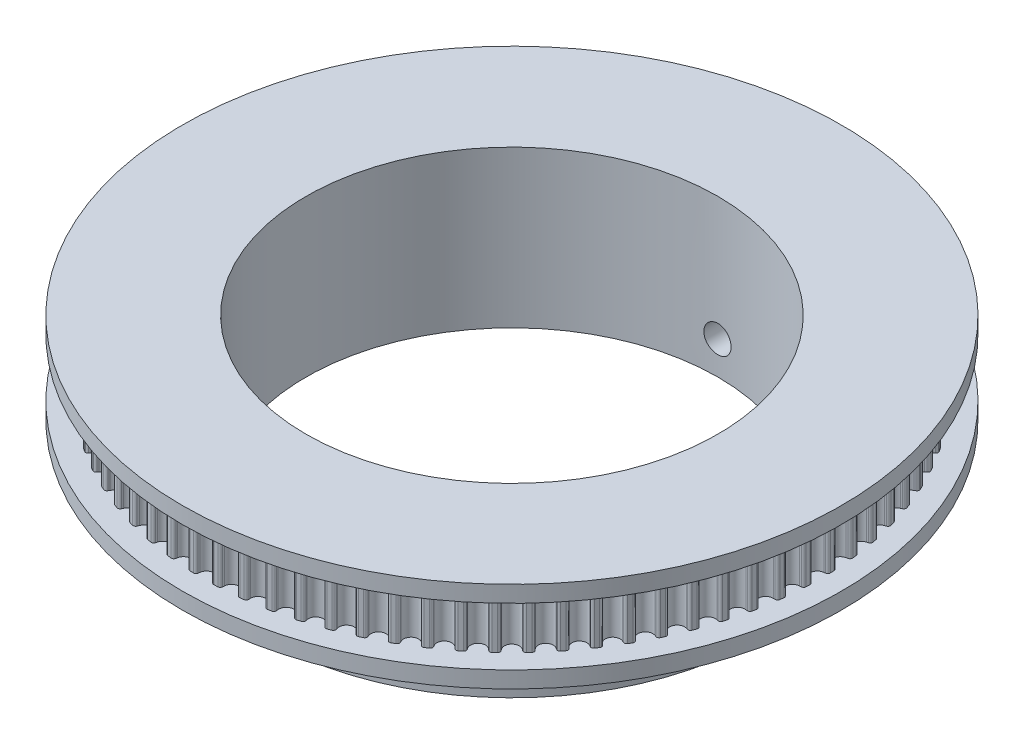
from build123d import *

# Parameters (mm, degrees)
SKETCH_1_R               = 40
EXTRUDE_1_DEPTH          = 5.5
SKETCH_2_OUTSIDE_W       = 104.734
SKETCH_2_OUTSIDE_H       = 104.734
CUT_EXTRUDE_1_DEPTH      = 3.5
SKETCH_3_R               = 25
CUT_EXTRUDE_2_DEPTH      = 58.628118137
SKETCH_4_R               = 30
SKETCH_4_R_2             = 25
EXTRUDE_2_DEPTH          = 8
SKETCH_7_W               = 1.65
SKETCH_7_H               = 40
PATTERN_CIRCULAR_1_COUNT = 3
PATTERN_CIRCULAR_1_ANGLE = 180


with BuildPart() as part:
    # 草图1 → 凸台-拉伸1 (new, symmetric)
    with BuildSketch(Plane(origin=(0, 0, 0), x_dir=(1, 0, 0), z_dir=(0, 1, 0))):
        Circle(SKETCH_1_R)
    extrude(amount=EXTRUDE_1_DEPTH, both=True)

    # 草图2 outside → 切除-拉伸1 (cut, symmetric)
    with BuildSketch(Plane(origin=(0, 0, 0), x_dir=(1, 0, 0), z_dir=(0, 1, 0))):
        Rectangle(SKETCH_2_OUTSIDE_W, SKETCH_2_OUTSIDE_H)
        with BuildLine():
            Line((-0.927435551, 37.150343182), (-0.903216998, 36.953098898))
            ThreePointArc((-0.903216998, 36.953098898), (0, 36.154), (0.903216998, 36.953098898))
            Line((0.903216998, 36.953098898), (0.927435551, 37.150343182))
            ThreePointArc((0.927435551, 37.150343182), (1.030147603, 37.34171833), (1.235097598, 37.413619043))
            ThreePointArc((1.235097598, 37.413619043), (1.469651943, 37.405139743), (1.704148514, 37.395189983))
            ThreePointArc((1.704148514, 37.395189983), (1.902825451, 37.307430724), (1.990205755, 37.108586826))
            Line((1.990205755, 37.108586826), (1.998874042, 36.910050415))
            ThreePointArc((1.998874042, 36.910050415), (2.836610147, 36.042549284), (3.799739405, 36.768319237))
            Line((3.799739405, 36.768319237), (3.839358909, 36.963055317))
            ThreePointArc((3.839358909, 36.963055317), (3.956769455, 37.145781825), (4.166728922, 37.201380701))
            ThreePointArc((4.166728922, 37.201380701), (4.399894936, 37.174524618), (4.632887983, 37.146207141))
            ThreePointArc((4.632887983, 37.146207141), (4.824066954, 37.043130401), (4.895576781, 36.838043694))
            Line((4.895576781, 36.838043694), (4.88864136, 36.639439198))
            ThreePointArc((4.88864136, 36.639439198), (5.655731649, 35.708884266), (6.672835156, 36.356850662))
            Line((6.672835156, 36.356850662), (6.727611342, 36.547877925))
            ThreePointArc((6.727611342, 36.547877925), (6.858996507, 36.720829223), (7.072670977, 36.759783477))
            ThreePointArc((7.072670977, 36.759783477), (7.303011114, 36.714716187), (7.533064158, 36.668205579))
            ThreePointArc((7.533064158, 36.668205579), (7.71556648, 36.550446862), (7.770764949, 36.340381772))
            Line((7.770764949, 36.340381772), (7.748268577, 36.142933654))
            ThreePointArc((7.748268577, 36.142933654), (8.439983685, 35.155062102), (9.504790658, 35.721230013))
            Line((9.504790658, 35.721230013), (9.574385814, 35.907370713))
            ThreePointArc((9.574385814, 35.907370713), (9.718935565, 36.069480498), (9.935007664, 36.091549963))
            ThreePointArc((9.935007664, 36.091549963), (10.1611018, 36.028549321), (10.386796487, 35.964132337))
            ThreePointArc((10.386796487, 35.964132337), (10.559496973, 35.832417663), (10.598043766, 35.618669312))
            Line((10.598043766, 35.618669312), (10.560125143, 35.423594906))
            ThreePointArc((10.560125143, 35.423594906), (11.172200415, 34.38449729), (12.278145966, 34.865376102))
            Line((12.278145966, 34.865376102), (12.362131014, 35.045482619))
            ThreePointArc((12.362131014, 35.045482619), (12.518954154, 35.195751431), (12.736091724, 35.200800042))
            ThreePointArc((12.736091724, 35.200800042), (12.956545915, 35.120254469), (13.176490761, 35.038328259))
            ThreePointArc((13.176490761, 35.038328259), (13.338324655, 34.893469694), (13.359982119, 34.677355911))
            Line((13.359982119, 34.677355911), (13.306875025, 34.485857915))
            ThreePointArc((13.306875025, 34.485857915), (13.835536814, 33.401940618), (14.97580242, 33.794565553))
            Line((14.97580242, 33.794565553), (15.073659565, 33.967527471))
            ThreePointArc((15.073659565, 33.967527471), (15.241789227, 34.105028853), (15.458653544, 34.093025483))
            ThreePointArc((15.458653544, 34.093025483), (15.672108615, 33.995431569), (15.884947589, 33.896501237))
            ThreePointArc((15.884947589, 33.896501237), (16.034917131, 33.739391881), (16.03955174, 33.52224508))
            Line((16.03955174, 33.52224508), (15.971583597, 33.335504143))
            ThreePointArc((15.971583597, 33.335504143), (16.413572528, 32.213449876), (17.581128073, 32.51540027))
            Line((17.581128073, 32.51540027), (17.692253993, 32.680151221))
            ThreePointArc((17.692253993, 32.680151221), (17.870653601, 32.804037431), (18.085907624, 32.775056085))
            ThreePointArc((18.085907624, 32.775056085), (18.291047554, 32.661015529), (18.495468432, 32.545691012))
            ThreePointArc((18.495468432, 32.545691012), (18.63264901, 32.377299498), (18.620232191, 32.16045846))
            Line((18.620232191, 32.16045846), (18.537822046, 31.979625902))
            ThreePointArc((18.537822046, 31.979625902), (18.890413109, 30.826352502), (20.078060225, 31.035766732))
            Line((20.078060225, 31.035766732), (20.201769792, 31.191290972))
            ThreePointArc((20.201769792, 31.191290972), (20.389339453, 31.30079821), (20.60165607, 31.255017568))
            ThreePointArc((20.60165607, 31.255017568), (20.797216103, 31.125233467), (20.991958562, 30.99422578))
            ThreePointArc((20.991958562, 30.99422578), (21.115504412, 30.815590297), (21.086112718, 30.60039192))
            Line((21.086112718, 30.60039192), (20.989768657, 30.426582634))
            ThreePointArc((20.989768657, 30.426582634), (21.250788011, 29.249200415), (22.451204459, 29.364787372))
            Line((22.451204459, 29.364787372), (22.586734961, 29.510126042))
            ThreePointArc((22.586734961, 29.510126042), (22.782318247, 29.604579159), (22.990388455, 29.542281474))
            ThreePointArc((22.990388455, 29.542281474), (23.175162898, 29.397553991), (23.359026287, 29.25167084))
            ThreePointArc((23.359026287, 29.25167084), (23.468175708, 29.063892734), (23.421990349, 28.851663788))
            Line((23.421990349, 28.851663788), (23.312306365, 28.685949366))
            ThreePointArc((23.312306365, 28.685949366), (23.480144739, 27.49171728), (24.685929552, 27.512764333))
            Line((24.685929552, 27.512764333), (24.8324454, 27.647021371))
            ThreePointArc((24.8324454, 27.647021371), (25.034836473, 27.725838034), (25.23737745, 27.647407391))
            ThreePointArc((25.23737745, 27.647407391), (25.410227108, 27.488628818), (25.582077847, 27.328769621))
            ThreePointArc((25.582077847, 27.328769621), (25.676157897, 27.133006608), (25.61346362, 26.925055554))
            Line((25.61346362, 26.925055554), (25.491115952, 26.76845768))
            ThreePointArc((25.491115952, 26.76845768), (25.564738567, 25.564738567), (26.76845768, 25.491115952))
            Line((26.76845768, 25.491115952), (26.925055554, 25.61346362))
            ThreePointArc((26.925055554, 25.61346362), (27.133006608, 25.676157897), (27.328769621, 25.582077847))
            ThreePointArc((27.328769621, 25.582077847), (27.488628818, 25.410227108), (27.647407391, 25.23737745))
            ThreePointArc((27.647407391, 25.23737745), (27.725838034, 25.034836473), (27.647021371, 24.8324454))
            Line((27.647021371, 24.8324454), (27.512764333, 24.685929552))
            ThreePointArc((27.512764333, 24.685929552), (27.49171728, 23.480144739), (28.685949366, 23.312306365))
            Line((28.685949366, 23.312306365), (28.851663788, 23.421990349))
            ThreePointArc((28.851663788, 23.421990349), (29.063892734, 23.468175708), (29.25167084, 23.359026287))
            ThreePointArc((29.25167084, 23.359026287), (29.397553991, 23.175162898), (29.542281474, 22.990388455))
            ThreePointArc((29.542281474, 22.990388455), (29.604579159, 22.782318247), (29.510126042, 22.586734961))
            Line((29.510126042, 22.586734961), (29.364787372, 22.451204459))
            ThreePointArc((29.364787372, 22.451204459), (29.249200415, 21.250788011), (30.426582634, 20.989768657))
            Line((30.426582634, 20.989768657), (30.60039192, 21.086112718))
            ThreePointArc((30.60039192, 21.086112718), (30.815590297, 21.115504412), (30.99422578, 20.991958562))
            ThreePointArc((30.99422578, 20.991958562), (31.125233467, 20.797216103), (31.255017568, 20.60165607))
            ThreePointArc((31.255017568, 20.60165607), (31.30079821, 20.389339453), (31.191290972, 20.201769792))
            Line((31.191290972, 20.201769792), (31.035766732, 20.078060225))
            ThreePointArc((31.035766732, 20.078060225), (30.826352502, 18.890413109), (31.979625902, 18.537822046))
            Line((31.979625902, 18.537822046), (32.16045846, 18.620232191))
            ThreePointArc((32.16045846, 18.620232191), (32.377299498, 18.63264901), (32.545691012, 18.495468432))
            ThreePointArc((32.545691012, 18.495468432), (32.661015529, 18.291047554), (32.775056085, 18.085907624))
            ThreePointArc((32.775056085, 18.085907624), (32.804037431, 17.870653601), (32.680151221, 17.692253993))
            Line((32.680151221, 17.692253993), (32.51540027, 17.581128073))
            ThreePointArc((32.51540027, 17.581128073), (32.213449876, 16.413572528), (33.335504143, 15.971583597))
            Line((33.335504143, 15.971583597), (33.52224508, 16.03955174))
            ThreePointArc((33.52224508, 16.03955174), (33.739391881, 16.034917131), (33.896501237, 15.884947589))
            ThreePointArc((33.896501237, 15.884947589), (33.995431569, 15.672108615), (34.093025483, 15.458653544))
            ThreePointArc((34.093025483, 15.458653544), (34.105028853, 15.241789227), (33.967527471, 15.073659565))
            Line((33.967527471, 15.073659565), (33.794565553, 14.97580242))
            ThreePointArc((33.794565553, 14.97580242), (33.401940618, 13.835536814), (34.485857915, 13.306875025))
            Line((34.485857915, 13.306875025), (34.677355911, 13.359982119))
            ThreePointArc((34.677355911, 13.359982119), (34.893469694, 13.338324655), (35.038328259, 13.176490761))
            ThreePointArc((35.038328259, 13.176490761), (35.120254469, 12.956545915), (35.200800042, 12.736091724))
            ThreePointArc((35.200800042, 12.736091724), (35.195751431, 12.518954154), (35.045482619, 12.362131014))
            Line((35.045482619, 12.362131014), (34.865376102, 12.278145966))
            ThreePointArc((34.865376102, 12.278145966), (34.38449729, 11.172200415), (35.423594906, 10.560125143))
            Line((35.423594906, 10.560125143), (35.618669312, 10.598043766))
            ThreePointArc((35.618669312, 10.598043766), (35.832417663, 10.559496973), (35.964132337, 10.386796487))
            ThreePointArc((35.964132337, 10.386796487), (36.028549321, 10.1611018), (36.091549963, 9.935007664))
            ThreePointArc((36.091549963, 9.935007664), (36.069480498, 9.718935565), (35.907370713, 9.574385814))
            Line((35.907370713, 9.574385814), (35.721230013, 9.504790658))
            ThreePointArc((35.721230013, 9.504790658), (35.155062102, 8.439983685), (36.142933654, 7.748268577))
            Line((36.142933654, 7.748268577), (36.340381772, 7.770764949))
            ThreePointArc((36.340381772, 7.770764949), (36.550446862, 7.71556648), (36.668205579, 7.533064158))
            ThreePointArc((36.668205579, 7.533064158), (36.714716187, 7.303011114), (36.759783477, 7.072670977))
            ThreePointArc((36.759783477, 7.072670977), (36.720829223, 6.858996507), (36.547877925, 6.727611342))
            Line((36.547877925, 6.727611342), (36.356850662, 6.672835156))
            ThreePointArc((36.356850662, 6.672835156), (35.708884266, 5.655731649), (36.639439198, 4.88864136))
            Line((36.639439198, 4.88864136), (36.838043694, 4.895576781))
            ThreePointArc((36.838043694, 4.895576781), (37.043130401, 4.824066954), (37.146207141, 4.632887983))
            ThreePointArc((37.146207141, 4.632887983), (37.174524618, 4.399894936), (37.201380701, 4.166728922))
            ThreePointArc((37.201380701, 4.166728922), (37.145781825, 3.956769455), (36.963055317, 3.839358909))
            Line((36.963055317, 3.839358909), (36.768319237, 3.799739405))
            ThreePointArc((36.768319237, 3.799739405), (36.042549284, 2.836610147), (36.910050415, 1.998874042))
            Line((36.910050415, 1.998874042), (37.108586826, 1.990205755))
            ThreePointArc((37.108586826, 1.990205755), (37.307430724, 1.902825451), (37.395189983, 1.704148514))
            ThreePointArc((37.395189983, 1.704148514), (37.405139743, 1.469651943), (37.413619043, 1.235097598))
            ThreePointArc((37.413619043, 1.235097598), (37.34171833, 1.030147603), (37.150343182, 0.927435551))
            Line((37.150343182, 0.927435551), (36.953098898, 0.903216998))
            ThreePointArc((36.953098898, 0.903216998), (36.154, 0), (36.953098898, -0.903216998))
            Line((36.953098898, -0.903216998), (37.150343182, -0.927435551))
            ThreePointArc((37.150343182, -0.927435551), (37.34171833, -1.030147603), (37.413619043, -1.235097598))
            ThreePointArc((37.413619043, -1.235097598), (37.405139743, -1.469651943), (37.395189983, -1.704148514))
            ThreePointArc((37.395189983, -1.704148514), (37.307430724, -1.902825451), (37.108586826, -1.990205755))
            Line((37.108586826, -1.990205755), (36.910050415, -1.998874042))
            ThreePointArc((36.910050415, -1.998874042), (36.042549284, -2.836610147), (36.768319237, -3.799739405))
            Line((36.768319237, -3.799739405), (36.963055317, -3.839358909))
            ThreePointArc((36.963055317, -3.839358909), (37.145781825, -3.956769455), (37.201380701, -4.166728922))
            ThreePointArc((37.201380701, -4.166728922), (37.174524618, -4.399894936), (37.146207141, -4.632887983))
            ThreePointArc((37.146207141, -4.632887983), (37.043130401, -4.824066954), (36.838043694, -4.895576781))
            Line((36.838043694, -4.895576781), (36.639439198, -4.88864136))
            ThreePointArc((36.639439198, -4.88864136), (35.708884266, -5.655731649), (36.356850662, -6.672835156))
            Line((36.356850662, -6.672835156), (36.547877925, -6.727611342))
            ThreePointArc((36.547877925, -6.727611342), (36.720829223, -6.858996507), (36.759783477, -7.072670977))
            ThreePointArc((36.759783477, -7.072670977), (36.714716187, -7.303011114), (36.668205579, -7.533064158))
            ThreePointArc((36.668205579, -7.533064158), (36.550446862, -7.71556648), (36.340381772, -7.770764949))
            Line((36.340381772, -7.770764949), (36.142933654, -7.748268577))
            ThreePointArc((36.142933654, -7.748268577), (35.155062102, -8.439983685), (35.721230013, -9.504790658))
            Line((35.721230013, -9.504790658), (35.907370713, -9.574385814))
            ThreePointArc((35.907370713, -9.574385814), (36.069480498, -9.718935565), (36.091549963, -9.935007664))
            ThreePointArc((36.091549963, -9.935007664), (36.028549321, -10.1611018), (35.964132337, -10.386796487))
            ThreePointArc((35.964132337, -10.386796487), (35.832417663, -10.559496973), (35.618669312, -10.598043766))
            Line((35.618669312, -10.598043766), (35.423594906, -10.560125143))
            ThreePointArc((35.423594906, -10.560125143), (34.38449729, -11.172200415), (34.865376102, -12.278145966))
            Line((34.865376102, -12.278145966), (35.045482619, -12.362131014))
            ThreePointArc((35.045482619, -12.362131014), (35.195751431, -12.518954154), (35.200800042, -12.736091724))
            ThreePointArc((35.200800042, -12.736091724), (35.120254469, -12.956545915), (35.038328259, -13.176490761))
            ThreePointArc((35.038328259, -13.176490761), (34.893469694, -13.338324655), (34.677355911, -13.359982119))
            Line((34.677355911, -13.359982119), (34.485857915, -13.306875025))
            ThreePointArc((34.485857915, -13.306875025), (33.401940618, -13.835536814), (33.794565553, -14.97580242))
            Line((33.794565553, -14.97580242), (33.967527471, -15.073659565))
            ThreePointArc((33.967527471, -15.073659565), (34.105028853, -15.241789227), (34.093025483, -15.458653544))
            ThreePointArc((34.093025483, -15.458653544), (33.995431569, -15.672108615), (33.896501237, -15.884947589))
            ThreePointArc((33.896501237, -15.884947589), (33.739391881, -16.034917131), (33.52224508, -16.03955174))
            Line((33.52224508, -16.03955174), (33.335504143, -15.971583597))
            ThreePointArc((33.335504143, -15.971583597), (32.213449876, -16.413572528), (32.51540027, -17.581128073))
            Line((32.51540027, -17.581128073), (32.680151221, -17.692253993))
            ThreePointArc((32.680151221, -17.692253993), (32.804037431, -17.870653601), (32.775056085, -18.085907624))
            ThreePointArc((32.775056085, -18.085907624), (32.661015529, -18.291047554), (32.545691012, -18.495468432))
            ThreePointArc((32.545691012, -18.495468432), (32.377299498, -18.63264901), (32.16045846, -18.620232191))
            Line((32.16045846, -18.620232191), (31.979625902, -18.537822046))
            ThreePointArc((31.979625902, -18.537822046), (30.826352502, -18.890413109), (31.035766732, -20.078060225))
            Line((31.035766732, -20.078060225), (31.191290972, -20.201769792))
            ThreePointArc((31.191290972, -20.201769792), (31.30079821, -20.389339453), (31.255017568, -20.60165607))
            ThreePointArc((31.255017568, -20.60165607), (31.125233467, -20.797216103), (30.99422578, -20.991958562))
            ThreePointArc((30.99422578, -20.991958562), (30.815590297, -21.115504412), (30.60039192, -21.086112718))
            Line((30.60039192, -21.086112718), (30.426582634, -20.989768657))
            ThreePointArc((30.426582634, -20.989768657), (29.249200415, -21.250788011), (29.364787372, -22.451204459))
            Line((29.364787372, -22.451204459), (29.510126042, -22.586734961))
            ThreePointArc((29.510126042, -22.586734961), (29.604579159, -22.782318247), (29.542281474, -22.990388455))
            ThreePointArc((29.542281474, -22.990388455), (29.397553991, -23.175162898), (29.25167084, -23.359026287))
            ThreePointArc((29.25167084, -23.359026287), (29.063892734, -23.468175708), (28.851663788, -23.421990349))
            Line((28.851663788, -23.421990349), (28.685949366, -23.312306365))
            ThreePointArc((28.685949366, -23.312306365), (27.49171728, -23.480144739), (27.512764333, -24.685929552))
            Line((27.512764333, -24.685929552), (27.647021371, -24.8324454))
            ThreePointArc((27.647021371, -24.8324454), (27.725838034, -25.034836473), (27.647407391, -25.23737745))
            ThreePointArc((27.647407391, -25.23737745), (27.488628818, -25.410227108), (27.328769621, -25.582077847))
            ThreePointArc((27.328769621, -25.582077847), (27.133006608, -25.676157897), (26.925055554, -25.61346362))
            Line((26.925055554, -25.61346362), (26.76845768, -25.491115952))
            ThreePointArc((26.76845768, -25.491115952), (25.564738567, -25.564738567), (25.491115952, -26.76845768))
            Line((25.491115952, -26.76845768), (25.61346362, -26.925055554))
            ThreePointArc((25.61346362, -26.925055554), (25.676157897, -27.133006608), (25.582077847, -27.328769621))
            ThreePointArc((25.582077847, -27.328769621), (25.410227108, -27.488628818), (25.23737745, -27.647407391))
            ThreePointArc((25.23737745, -27.647407391), (25.034836473, -27.725838034), (24.8324454, -27.647021371))
            Line((24.8324454, -27.647021371), (24.685929552, -27.512764333))
            ThreePointArc((24.685929552, -27.512764333), (23.480144739, -27.49171728), (23.312306365, -28.685949366))
            Line((23.312306365, -28.685949366), (23.421990349, -28.851663788))
            ThreePointArc((23.421990349, -28.851663788), (23.468175708, -29.063892734), (23.359026287, -29.25167084))
            ThreePointArc((23.359026287, -29.25167084), (23.175162898, -29.397553991), (22.990388455, -29.542281474))
            ThreePointArc((22.990388455, -29.542281474), (22.782318247, -29.604579159), (22.586734961, -29.510126042))
            Line((22.586734961, -29.510126042), (22.451204459, -29.364787372))
            ThreePointArc((22.451204459, -29.364787372), (21.250788011, -29.249200415), (20.989768657, -30.426582634))
            Line((20.989768657, -30.426582634), (21.086112718, -30.60039192))
            ThreePointArc((21.086112718, -30.60039192), (21.115504412, -30.815590297), (20.991958562, -30.99422578))
            ThreePointArc((20.991958562, -30.99422578), (20.797216103, -31.125233467), (20.60165607, -31.255017568))
            ThreePointArc((20.60165607, -31.255017568), (20.389339453, -31.30079821), (20.201769792, -31.191290972))
            Line((20.201769792, -31.191290972), (20.078060225, -31.035766732))
            ThreePointArc((20.078060225, -31.035766732), (18.890413109, -30.826352502), (18.537822046, -31.979625902))
            Line((18.537822046, -31.979625902), (18.620232191, -32.16045846))
            ThreePointArc((18.620232191, -32.16045846), (18.63264901, -32.377299498), (18.495468432, -32.545691012))
            ThreePointArc((18.495468432, -32.545691012), (18.291047554, -32.661015529), (18.085907624, -32.775056085))
            ThreePointArc((18.085907624, -32.775056085), (17.870653601, -32.804037431), (17.692253993, -32.680151221))
            Line((17.692253993, -32.680151221), (17.581128073, -32.51540027))
            ThreePointArc((17.581128073, -32.51540027), (16.413572528, -32.213449876), (15.971583597, -33.335504143))
            Line((15.971583597, -33.335504143), (16.03955174, -33.52224508))
            ThreePointArc((16.03955174, -33.52224508), (16.034917131, -33.739391881), (15.884947589, -33.896501237))
            ThreePointArc((15.884947589, -33.896501237), (15.672108615, -33.995431569), (15.458653544, -34.093025483))
            ThreePointArc((15.458653544, -34.093025483), (15.241789227, -34.105028853), (15.073659565, -33.967527471))
            Line((15.073659565, -33.967527471), (14.97580242, -33.794565553))
            ThreePointArc((14.97580242, -33.794565553), (13.835536814, -33.401940618), (13.306875025, -34.485857915))
            Line((13.306875025, -34.485857915), (13.359982119, -34.677355911))
            ThreePointArc((13.359982119, -34.677355911), (13.338324655, -34.893469694), (13.176490761, -35.038328259))
            ThreePointArc((13.176490761, -35.038328259), (12.956545915, -35.120254469), (12.736091724, -35.200800042))
            ThreePointArc((12.736091724, -35.200800042), (12.518954154, -35.195751431), (12.362131014, -35.045482619))
            Line((12.362131014, -35.045482619), (12.278145966, -34.865376102))
            ThreePointArc((12.278145966, -34.865376102), (11.172200415, -34.38449729), (10.560125143, -35.423594906))
            Line((10.560125143, -35.423594906), (10.598043766, -35.618669312))
            ThreePointArc((10.598043766, -35.618669312), (10.559496973, -35.832417663), (10.386796487, -35.964132337))
            ThreePointArc((10.386796487, -35.964132337), (10.1611018, -36.028549321), (9.935007664, -36.091549963))
            ThreePointArc((9.935007664, -36.091549963), (9.718935565, -36.069480498), (9.574385814, -35.907370713))
            Line((9.574385814, -35.907370713), (9.504790658, -35.721230013))
            ThreePointArc((9.504790658, -35.721230013), (8.439983685, -35.155062102), (7.748268577, -36.142933654))
            Line((7.748268577, -36.142933654), (7.770764949, -36.340381772))
            ThreePointArc((7.770764949, -36.340381772), (7.71556648, -36.550446862), (7.533064158, -36.668205579))
            ThreePointArc((7.533064158, -36.668205579), (7.303011114, -36.714716187), (7.072670977, -36.759783477))
            ThreePointArc((7.072670977, -36.759783477), (6.858996507, -36.720829223), (6.727611342, -36.547877925))
            Line((6.727611342, -36.547877925), (6.672835156, -36.356850662))
            ThreePointArc((6.672835156, -36.356850662), (5.655731649, -35.708884266), (4.88864136, -36.639439198))
            Line((4.88864136, -36.639439198), (4.895576781, -36.838043694))
            ThreePointArc((4.895576781, -36.838043694), (4.824066954, -37.043130401), (4.632887983, -37.146207141))
            ThreePointArc((4.632887983, -37.146207141), (4.399894936, -37.174524618), (4.166728922, -37.201380701))
            ThreePointArc((4.166728922, -37.201380701), (3.956769455, -37.145781825), (3.839358909, -36.963055317))
            Line((3.839358909, -36.963055317), (3.799739405, -36.768319237))
            ThreePointArc((3.799739405, -36.768319237), (2.836610147, -36.042549284), (1.998874042, -36.910050415))
            Line((1.998874042, -36.910050415), (1.990205755, -37.108586826))
            ThreePointArc((1.990205755, -37.108586826), (1.902825451, -37.307430724), (1.704148514, -37.395189983))
            ThreePointArc((1.704148514, -37.395189983), (1.469651943, -37.405139743), (1.235097598, -37.413619043))
            ThreePointArc((1.235097598, -37.413619043), (1.030147603, -37.34171833), (0.927435551, -37.150343182))
            Line((0.927435551, -37.150343182), (0.903216998, -36.953098898))
            ThreePointArc((0.903216998, -36.953098898), (0, -36.154), (-0.903216998, -36.953098898))
            Line((-0.903216998, -36.953098898), (-0.927435551, -37.150343182))
            ThreePointArc((-0.927435551, -37.150343182), (-1.030147603, -37.34171833), (-1.235097598, -37.413619043))
            ThreePointArc((-1.235097598, -37.413619043), (-1.469651943, -37.405139743), (-1.704148514, -37.395189983))
            ThreePointArc((-1.704148514, -37.395189983), (-1.902825451, -37.307430724), (-1.990205755, -37.108586826))
            Line((-1.990205755, -37.108586826), (-1.998874042, -36.910050415))
            ThreePointArc((-1.998874042, -36.910050415), (-2.836610147, -36.042549284), (-3.799739405, -36.768319237))
            Line((-3.799739405, -36.768319237), (-3.839358909, -36.963055317))
            ThreePointArc((-3.839358909, -36.963055317), (-3.956769455, -37.145781825), (-4.166728922, -37.201380701))
            ThreePointArc((-4.166728922, -37.201380701), (-4.399894936, -37.174524618), (-4.632887983, -37.146207141))
            ThreePointArc((-4.632887983, -37.146207141), (-4.824066954, -37.043130401), (-4.895576781, -36.838043694))
            Line((-4.895576781, -36.838043694), (-4.88864136, -36.639439198))
            ThreePointArc((-4.88864136, -36.639439198), (-5.655731649, -35.708884266), (-6.672835156, -36.356850662))
            Line((-6.672835156, -36.356850662), (-6.727611342, -36.547877925))
            ThreePointArc((-6.727611342, -36.547877925), (-6.858996507, -36.720829223), (-7.072670977, -36.759783477))
            ThreePointArc((-7.072670977, -36.759783477), (-7.303011114, -36.714716187), (-7.533064158, -36.668205579))
            ThreePointArc((-7.533064158, -36.668205579), (-7.71556648, -36.550446862), (-7.770764949, -36.340381772))
            Line((-7.770764949, -36.340381772), (-7.748268577, -36.142933654))
            ThreePointArc((-7.748268577, -36.142933654), (-8.439983685, -35.155062102), (-9.504790658, -35.721230013))
            Line((-9.504790658, -35.721230013), (-9.574385814, -35.907370713))
            ThreePointArc((-9.574385814, -35.907370713), (-9.718935565, -36.069480498), (-9.935007664, -36.091549963))
            ThreePointArc((-9.935007664, -36.091549963), (-10.1611018, -36.028549321), (-10.386796487, -35.964132337))
            ThreePointArc((-10.386796487, -35.964132337), (-10.559496973, -35.832417663), (-10.598043766, -35.618669312))
            Line((-10.598043766, -35.618669312), (-10.560125143, -35.423594906))
            ThreePointArc((-10.560125143, -35.423594906), (-11.172200415, -34.38449729), (-12.278145966, -34.865376102))
            Line((-12.278145966, -34.865376102), (-12.362131014, -35.045482619))
            ThreePointArc((-12.362131014, -35.045482619), (-12.518954154, -35.195751431), (-12.736091724, -35.200800042))
            ThreePointArc((-12.736091724, -35.200800042), (-12.956545915, -35.120254469), (-13.176490761, -35.038328259))
            ThreePointArc((-13.176490761, -35.038328259), (-13.338324655, -34.893469694), (-13.359982119, -34.677355911))
            Line((-13.359982119, -34.677355911), (-13.306875025, -34.485857915))
            ThreePointArc((-13.306875025, -34.485857915), (-13.835536814, -33.401940618), (-14.97580242, -33.794565553))
            Line((-14.97580242, -33.794565553), (-15.073659565, -33.967527471))
            ThreePointArc((-15.073659565, -33.967527471), (-15.241789227, -34.105028853), (-15.458653544, -34.093025483))
            ThreePointArc((-15.458653544, -34.093025483), (-15.672108615, -33.995431569), (-15.884947589, -33.896501237))
            ThreePointArc((-15.884947589, -33.896501237), (-16.034917131, -33.739391881), (-16.03955174, -33.52224508))
            Line((-16.03955174, -33.52224508), (-15.971583597, -33.335504143))
            ThreePointArc((-15.971583597, -33.335504143), (-16.413572528, -32.213449876), (-17.581128073, -32.51540027))
            Line((-17.581128073, -32.51540027), (-17.692253993, -32.680151221))
            ThreePointArc((-17.692253993, -32.680151221), (-17.870653601, -32.804037431), (-18.085907624, -32.775056085))
            ThreePointArc((-18.085907624, -32.775056085), (-18.291047554, -32.661015529), (-18.495468432, -32.545691012))
            ThreePointArc((-18.495468432, -32.545691012), (-18.63264901, -32.377299498), (-18.620232191, -32.16045846))
            Line((-18.620232191, -32.16045846), (-18.537822046, -31.979625902))
            ThreePointArc((-18.537822046, -31.979625902), (-18.890413109, -30.826352502), (-20.078060225, -31.035766732))
            Line((-20.078060225, -31.035766732), (-20.201769792, -31.191290972))
            ThreePointArc((-20.201769792, -31.191290972), (-20.389339453, -31.30079821), (-20.60165607, -31.255017568))
            ThreePointArc((-20.60165607, -31.255017568), (-20.797216103, -31.125233467), (-20.991958562, -30.99422578))
            ThreePointArc((-20.991958562, -30.99422578), (-21.115504412, -30.815590297), (-21.086112718, -30.60039192))
            Line((-21.086112718, -30.60039192), (-20.989768657, -30.426582634))
            ThreePointArc((-20.989768657, -30.426582634), (-21.250788011, -29.249200415), (-22.451204459, -29.364787372))
            Line((-22.451204459, -29.364787372), (-22.586734961, -29.510126042))
            ThreePointArc((-22.586734961, -29.510126042), (-22.782318247, -29.604579159), (-22.990388455, -29.542281474))
            ThreePointArc((-22.990388455, -29.542281474), (-23.175162898, -29.397553991), (-23.359026287, -29.25167084))
            ThreePointArc((-23.359026287, -29.25167084), (-23.468175708, -29.063892734), (-23.421990349, -28.851663788))
            Line((-23.421990349, -28.851663788), (-23.312306365, -28.685949366))
            ThreePointArc((-23.312306365, -28.685949366), (-23.480144739, -27.49171728), (-24.685929552, -27.512764333))
            Line((-24.685929552, -27.512764333), (-24.8324454, -27.647021371))
            ThreePointArc((-24.8324454, -27.647021371), (-25.034836473, -27.725838034), (-25.23737745, -27.647407391))
            ThreePointArc((-25.23737745, -27.647407391), (-25.410227108, -27.488628818), (-25.582077847, -27.328769621))
            ThreePointArc((-25.582077847, -27.328769621), (-25.676157897, -27.133006608), (-25.61346362, -26.925055554))
            Line((-25.61346362, -26.925055554), (-25.491115952, -26.76845768))
            ThreePointArc((-25.491115952, -26.76845768), (-25.564738567, -25.564738567), (-26.76845768, -25.491115952))
            Line((-26.76845768, -25.491115952), (-26.925055554, -25.61346362))
            ThreePointArc((-26.925055554, -25.61346362), (-27.133006608, -25.676157897), (-27.328769621, -25.582077847))
            ThreePointArc((-27.328769621, -25.582077847), (-27.488628818, -25.410227108), (-27.647407391, -25.23737745))
            ThreePointArc((-27.647407391, -25.23737745), (-27.725838034, -25.034836473), (-27.647021371, -24.8324454))
            Line((-27.647021371, -24.8324454), (-27.512764333, -24.685929552))
            ThreePointArc((-27.512764333, -24.685929552), (-27.49171728, -23.480144739), (-28.685949366, -23.312306365))
            Line((-28.685949366, -23.312306365), (-28.851663788, -23.421990349))
            ThreePointArc((-28.851663788, -23.421990349), (-29.063892734, -23.468175708), (-29.25167084, -23.359026287))
            ThreePointArc((-29.25167084, -23.359026287), (-29.397553991, -23.175162898), (-29.542281474, -22.990388455))
            ThreePointArc((-29.542281474, -22.990388455), (-29.604579159, -22.782318247), (-29.510126042, -22.586734961))
            Line((-29.510126042, -22.586734961), (-29.364787372, -22.451204459))
            ThreePointArc((-29.364787372, -22.451204459), (-29.249200415, -21.250788011), (-30.426582634, -20.989768657))
            Line((-30.426582634, -20.989768657), (-30.60039192, -21.086112718))
            ThreePointArc((-30.60039192, -21.086112718), (-30.815590297, -21.115504412), (-30.99422578, -20.991958562))
            ThreePointArc((-30.99422578, -20.991958562), (-31.125233467, -20.797216103), (-31.255017568, -20.60165607))
            ThreePointArc((-31.255017568, -20.60165607), (-31.30079821, -20.389339453), (-31.191290972, -20.201769792))
            Line((-31.191290972, -20.201769792), (-31.035766732, -20.078060225))
            ThreePointArc((-31.035766732, -20.078060225), (-30.826352502, -18.890413109), (-31.979625902, -18.537822046))
            Line((-31.979625902, -18.537822046), (-32.16045846, -18.620232191))
            ThreePointArc((-32.16045846, -18.620232191), (-32.377299498, -18.63264901), (-32.545691012, -18.495468432))
            ThreePointArc((-32.545691012, -18.495468432), (-32.661015529, -18.291047554), (-32.775056085, -18.085907624))
            ThreePointArc((-32.775056085, -18.085907624), (-32.804037431, -17.870653601), (-32.680151221, -17.692253993))
            Line((-32.680151221, -17.692253993), (-32.51540027, -17.581128073))
            ThreePointArc((-32.51540027, -17.581128073), (-32.213449876, -16.413572528), (-33.335504143, -15.971583597))
            Line((-33.335504143, -15.971583597), (-33.52224508, -16.03955174))
            ThreePointArc((-33.52224508, -16.03955174), (-33.739391881, -16.034917131), (-33.896501237, -15.884947589))
            ThreePointArc((-33.896501237, -15.884947589), (-33.995431569, -15.672108615), (-34.093025483, -15.458653544))
            ThreePointArc((-34.093025483, -15.458653544), (-34.105028853, -15.241789227), (-33.967527471, -15.073659565))
            Line((-33.967527471, -15.073659565), (-33.794565553, -14.97580242))
            ThreePointArc((-33.794565553, -14.97580242), (-33.401940618, -13.835536814), (-34.485857915, -13.306875025))
            Line((-34.485857915, -13.306875025), (-34.677355911, -13.359982119))
            ThreePointArc((-34.677355911, -13.359982119), (-34.893469694, -13.338324655), (-35.038328259, -13.176490761))
            ThreePointArc((-35.038328259, -13.176490761), (-35.120254469, -12.956545915), (-35.200800042, -12.736091724))
            ThreePointArc((-35.200800042, -12.736091724), (-35.195751431, -12.518954154), (-35.045482619, -12.362131014))
            Line((-35.045482619, -12.362131014), (-34.865376102, -12.278145966))
            ThreePointArc((-34.865376102, -12.278145966), (-34.38449729, -11.172200415), (-35.423594906, -10.560125143))
            Line((-35.423594906, -10.560125143), (-35.618669312, -10.598043766))
            ThreePointArc((-35.618669312, -10.598043766), (-35.832417663, -10.559496973), (-35.964132337, -10.386796487))
            ThreePointArc((-35.964132337, -10.386796487), (-36.028549321, -10.1611018), (-36.091549963, -9.935007664))
            ThreePointArc((-36.091549963, -9.935007664), (-36.069480498, -9.718935565), (-35.907370713, -9.574385814))
            Line((-35.907370713, -9.574385814), (-35.721230013, -9.504790658))
            ThreePointArc((-35.721230013, -9.504790658), (-35.155062102, -8.439983685), (-36.142933654, -7.748268577))
            Line((-36.142933654, -7.748268577), (-36.340381772, -7.770764949))
            ThreePointArc((-36.340381772, -7.770764949), (-36.550446862, -7.71556648), (-36.668205579, -7.533064158))
            ThreePointArc((-36.668205579, -7.533064158), (-36.714716187, -7.303011114), (-36.759783477, -7.072670977))
            ThreePointArc((-36.759783477, -7.072670977), (-36.720829223, -6.858996507), (-36.547877925, -6.727611342))
            Line((-36.547877925, -6.727611342), (-36.356850662, -6.672835156))
            ThreePointArc((-36.356850662, -6.672835156), (-35.708884266, -5.655731649), (-36.639439198, -4.88864136))
            Line((-36.639439198, -4.88864136), (-36.838043694, -4.895576781))
            ThreePointArc((-36.838043694, -4.895576781), (-37.043130401, -4.824066954), (-37.146207141, -4.632887983))
            ThreePointArc((-37.146207141, -4.632887983), (-37.174524618, -4.399894936), (-37.201380701, -4.166728922))
            ThreePointArc((-37.201380701, -4.166728922), (-37.145781825, -3.956769455), (-36.963055317, -3.839358909))
            Line((-36.963055317, -3.839358909), (-36.768319237, -3.799739405))
            ThreePointArc((-36.768319237, -3.799739405), (-36.042549284, -2.836610147), (-36.910050415, -1.998874042))
            Line((-36.910050415, -1.998874042), (-37.108586826, -1.990205755))
            ThreePointArc((-37.108586826, -1.990205755), (-37.307430724, -1.902825451), (-37.395189983, -1.704148514))
            ThreePointArc((-37.395189983, -1.704148514), (-37.405139743, -1.469651943), (-37.413619043, -1.235097598))
            ThreePointArc((-37.413619043, -1.235097598), (-37.34171833, -1.030147603), (-37.150343182, -0.927435551))
            Line((-37.150343182, -0.927435551), (-36.953098898, -0.903216998))
            ThreePointArc((-36.953098898, -0.903216998), (-36.154, 0), (-36.953098898, 0.903216998))
            Line((-36.953098898, 0.903216998), (-37.150343182, 0.927435551))
            ThreePointArc((-37.150343182, 0.927435551), (-37.34171833, 1.030147603), (-37.413619043, 1.235097598))
            ThreePointArc((-37.413619043, 1.235097598), (-37.405139743, 1.469651943), (-37.395189983, 1.704148514))
            ThreePointArc((-37.395189983, 1.704148514), (-37.307430724, 1.902825451), (-37.108586826, 1.990205755))
            Line((-37.108586826, 1.990205755), (-36.910050415, 1.998874042))
            ThreePointArc((-36.910050415, 1.998874042), (-36.042549284, 2.836610147), (-36.768319237, 3.799739405))
            Line((-36.768319237, 3.799739405), (-36.963055317, 3.839358909))
            ThreePointArc((-36.963055317, 3.839358909), (-37.145781825, 3.956769455), (-37.201380701, 4.166728922))
            ThreePointArc((-37.201380701, 4.166728922), (-37.174524618, 4.399894936), (-37.146207141, 4.632887983))
            ThreePointArc((-37.146207141, 4.632887983), (-37.043130401, 4.824066954), (-36.838043694, 4.895576781))
            Line((-36.838043694, 4.895576781), (-36.639439198, 4.88864136))
            ThreePointArc((-36.639439198, 4.88864136), (-35.708884266, 5.655731649), (-36.356850662, 6.672835156))
            Line((-36.356850662, 6.672835156), (-36.547877925, 6.727611342))
            ThreePointArc((-36.547877925, 6.727611342), (-36.720829223, 6.858996507), (-36.759783477, 7.072670977))
            ThreePointArc((-36.759783477, 7.072670977), (-36.714716187, 7.303011114), (-36.668205579, 7.533064158))
            ThreePointArc((-36.668205579, 7.533064158), (-36.550446862, 7.71556648), (-36.340381772, 7.770764949))
            Line((-36.340381772, 7.770764949), (-36.142933654, 7.748268577))
            ThreePointArc((-36.142933654, 7.748268577), (-35.155062102, 8.439983685), (-35.721230013, 9.504790658))
            Line((-35.721230013, 9.504790658), (-35.907370713, 9.574385814))
            ThreePointArc((-35.907370713, 9.574385814), (-36.069480498, 9.718935565), (-36.091549963, 9.935007664))
            ThreePointArc((-36.091549963, 9.935007664), (-36.028549321, 10.1611018), (-35.964132337, 10.386796487))
            ThreePointArc((-35.964132337, 10.386796487), (-35.832417663, 10.559496973), (-35.618669312, 10.598043766))
            Line((-35.618669312, 10.598043766), (-35.423594906, 10.560125143))
            ThreePointArc((-35.423594906, 10.560125143), (-34.38449729, 11.172200415), (-34.865376102, 12.278145966))
            Line((-34.865376102, 12.278145966), (-35.045482619, 12.362131014))
            ThreePointArc((-35.045482619, 12.362131014), (-35.195751431, 12.518954154), (-35.200800042, 12.736091724))
            ThreePointArc((-35.200800042, 12.736091724), (-35.120254469, 12.956545915), (-35.038328259, 13.176490761))
            ThreePointArc((-35.038328259, 13.176490761), (-34.893469694, 13.338324655), (-34.677355911, 13.359982119))
            Line((-34.677355911, 13.359982119), (-34.485857915, 13.306875025))
            ThreePointArc((-34.485857915, 13.306875025), (-33.401940618, 13.835536814), (-33.794565553, 14.97580242))
            Line((-33.794565553, 14.97580242), (-33.967527471, 15.073659565))
            ThreePointArc((-33.967527471, 15.073659565), (-34.105028853, 15.241789227), (-34.093025483, 15.458653544))
            ThreePointArc((-34.093025483, 15.458653544), (-33.995431569, 15.672108615), (-33.896501237, 15.884947589))
            ThreePointArc((-33.896501237, 15.884947589), (-33.739391881, 16.034917131), (-33.52224508, 16.03955174))
            Line((-33.52224508, 16.03955174), (-33.335504143, 15.971583597))
            ThreePointArc((-33.335504143, 15.971583597), (-32.213449876, 16.413572528), (-32.51540027, 17.581128073))
            Line((-32.51540027, 17.581128073), (-32.680151221, 17.692253993))
            ThreePointArc((-32.680151221, 17.692253993), (-32.804037431, 17.870653601), (-32.775056085, 18.085907624))
            ThreePointArc((-32.775056085, 18.085907624), (-32.661015529, 18.291047554), (-32.545691012, 18.495468432))
            ThreePointArc((-32.545691012, 18.495468432), (-32.377299498, 18.63264901), (-32.16045846, 18.620232191))
            Line((-32.16045846, 18.620232191), (-31.979625902, 18.537822046))
            ThreePointArc((-31.979625902, 18.537822046), (-30.826352502, 18.890413109), (-31.035766732, 20.078060225))
            Line((-31.035766732, 20.078060225), (-31.191290972, 20.201769792))
            ThreePointArc((-31.191290972, 20.201769792), (-31.30079821, 20.389339453), (-31.255017568, 20.60165607))
            ThreePointArc((-31.255017568, 20.60165607), (-31.125233467, 20.797216103), (-30.99422578, 20.991958562))
            ThreePointArc((-30.99422578, 20.991958562), (-30.815590297, 21.115504412), (-30.60039192, 21.086112718))
            Line((-30.60039192, 21.086112718), (-30.426582634, 20.989768657))
            ThreePointArc((-30.426582634, 20.989768657), (-29.249200415, 21.250788011), (-29.364787372, 22.451204459))
            Line((-29.364787372, 22.451204459), (-29.510126042, 22.586734961))
            ThreePointArc((-29.510126042, 22.586734961), (-29.604579159, 22.782318247), (-29.542281474, 22.990388455))
            ThreePointArc((-29.542281474, 22.990388455), (-29.397553991, 23.175162898), (-29.25167084, 23.359026287))
            ThreePointArc((-29.25167084, 23.359026287), (-29.063892734, 23.468175708), (-28.851663788, 23.421990349))
            Line((-28.851663788, 23.421990349), (-28.685949366, 23.312306365))
            ThreePointArc((-28.685949366, 23.312306365), (-27.49171728, 23.480144739), (-27.512764333, 24.685929552))
            Line((-27.512764333, 24.685929552), (-27.647021371, 24.8324454))
            ThreePointArc((-27.647021371, 24.8324454), (-27.725838034, 25.034836473), (-27.647407391, 25.23737745))
            ThreePointArc((-27.647407391, 25.23737745), (-27.488628818, 25.410227108), (-27.328769621, 25.582077847))
            ThreePointArc((-27.328769621, 25.582077847), (-27.133006608, 25.676157897), (-26.925055554, 25.61346362))
            Line((-26.925055554, 25.61346362), (-26.76845768, 25.491115952))
            ThreePointArc((-26.76845768, 25.491115952), (-25.564738567, 25.564738567), (-25.491115952, 26.76845768))
            Line((-25.491115952, 26.76845768), (-25.61346362, 26.925055554))
            ThreePointArc((-25.61346362, 26.925055554), (-25.676157897, 27.133006608), (-25.582077847, 27.328769621))
            ThreePointArc((-25.582077847, 27.328769621), (-25.410227108, 27.488628818), (-25.23737745, 27.647407391))
            ThreePointArc((-25.23737745, 27.647407391), (-25.034836473, 27.725838034), (-24.8324454, 27.647021371))
            Line((-24.8324454, 27.647021371), (-24.685929552, 27.512764333))
            ThreePointArc((-24.685929552, 27.512764333), (-23.480144739, 27.49171728), (-23.312306365, 28.685949366))
            Line((-23.312306365, 28.685949366), (-23.421990349, 28.851663788))
            ThreePointArc((-23.421990349, 28.851663788), (-23.468175708, 29.063892734), (-23.359026287, 29.25167084))
            ThreePointArc((-23.359026287, 29.25167084), (-23.175162898, 29.397553991), (-22.990388455, 29.542281474))
            ThreePointArc((-22.990388455, 29.542281474), (-22.782318247, 29.604579159), (-22.586734961, 29.510126042))
            Line((-22.586734961, 29.510126042), (-22.451204459, 29.364787372))
            ThreePointArc((-22.451204459, 29.364787372), (-21.250788011, 29.249200415), (-20.989768657, 30.426582634))
            Line((-20.989768657, 30.426582634), (-21.086112718, 30.60039192))
            ThreePointArc((-21.086112718, 30.60039192), (-21.115504412, 30.815590297), (-20.991958562, 30.99422578))
            ThreePointArc((-20.991958562, 30.99422578), (-20.797216103, 31.125233467), (-20.60165607, 31.255017568))
            ThreePointArc((-20.60165607, 31.255017568), (-20.389339453, 31.30079821), (-20.201769792, 31.191290972))
            Line((-20.201769792, 31.191290972), (-20.078060225, 31.035766732))
            ThreePointArc((-20.078060225, 31.035766732), (-18.890413109, 30.826352502), (-18.537822046, 31.979625902))
            Line((-18.537822046, 31.979625902), (-18.620232191, 32.16045846))
            ThreePointArc((-18.620232191, 32.16045846), (-18.63264901, 32.377299498), (-18.495468432, 32.545691012))
            ThreePointArc((-18.495468432, 32.545691012), (-18.291047554, 32.661015529), (-18.085907624, 32.775056085))
            ThreePointArc((-18.085907624, 32.775056085), (-17.870653601, 32.804037431), (-17.692253993, 32.680151221))
            Line((-17.692253993, 32.680151221), (-17.581128073, 32.51540027))
            ThreePointArc((-17.581128073, 32.51540027), (-16.413572528, 32.213449876), (-15.971583597, 33.335504143))
            Line((-15.971583597, 33.335504143), (-16.03955174, 33.52224508))
            ThreePointArc((-16.03955174, 33.52224508), (-16.034917131, 33.739391881), (-15.884947589, 33.896501237))
            ThreePointArc((-15.884947589, 33.896501237), (-15.672108615, 33.995431569), (-15.458653544, 34.093025483))
            ThreePointArc((-15.458653544, 34.093025483), (-15.241789227, 34.105028853), (-15.073659565, 33.967527471))
            Line((-15.073659565, 33.967527471), (-14.97580242, 33.794565553))
            ThreePointArc((-14.97580242, 33.794565553), (-13.835536814, 33.401940618), (-13.306875025, 34.485857915))
            Line((-13.306875025, 34.485857915), (-13.359982119, 34.677355911))
            ThreePointArc((-13.359982119, 34.677355911), (-13.338324655, 34.893469694), (-13.176490761, 35.038328259))
            ThreePointArc((-13.176490761, 35.038328259), (-12.956545915, 35.120254469), (-12.736091724, 35.200800042))
            ThreePointArc((-12.736091724, 35.200800042), (-12.518954154, 35.195751431), (-12.362131014, 35.045482619))
            Line((-12.362131014, 35.045482619), (-12.278145966, 34.865376102))
            ThreePointArc((-12.278145966, 34.865376102), (-11.172200415, 34.38449729), (-10.560125143, 35.423594906))
            Line((-10.560125143, 35.423594906), (-10.598043766, 35.618669312))
            ThreePointArc((-10.598043766, 35.618669312), (-10.559496973, 35.832417663), (-10.386796487, 35.964132337))
            ThreePointArc((-10.386796487, 35.964132337), (-10.1611018, 36.028549321), (-9.935007664, 36.091549963))
            ThreePointArc((-9.935007664, 36.091549963), (-9.718935565, 36.069480498), (-9.574385814, 35.907370713))
            Line((-9.574385814, 35.907370713), (-9.504790658, 35.721230013))
            ThreePointArc((-9.504790658, 35.721230013), (-8.439983685, 35.155062102), (-7.748268577, 36.142933654))
            Line((-7.748268577, 36.142933654), (-7.770764949, 36.340381772))
            ThreePointArc((-7.770764949, 36.340381772), (-7.71556648, 36.550446862), (-7.533064158, 36.668205579))
            ThreePointArc((-7.533064158, 36.668205579), (-7.303011114, 36.714716187), (-7.072670977, 36.759783477))
            ThreePointArc((-7.072670977, 36.759783477), (-6.858996507, 36.720829223), (-6.727611342, 36.547877925))
            Line((-6.727611342, 36.547877925), (-6.672835156, 36.356850662))
            ThreePointArc((-6.672835156, 36.356850662), (-5.655731649, 35.708884266), (-4.88864136, 36.639439198))
            Line((-4.88864136, 36.639439198), (-4.895576781, 36.838043694))
            ThreePointArc((-4.895576781, 36.838043694), (-4.824066954, 37.043130401), (-4.632887983, 37.146207141))
            ThreePointArc((-4.632887983, 37.146207141), (-4.399894936, 37.174524618), (-4.166728922, 37.201380701))
            ThreePointArc((-4.166728922, 37.201380701), (-3.956769455, 37.145781825), (-3.839358909, 36.963055317))
            Line((-3.839358909, 36.963055317), (-3.799739405, 36.768319237))
            ThreePointArc((-3.799739405, 36.768319237), (-2.836610147, 36.042549284), (-1.998874042, 36.910050415))
            Line((-1.998874042, 36.910050415), (-1.990205755, 37.108586826))
            ThreePointArc((-1.990205755, 37.108586826), (-1.902825451, 37.307430724), (-1.704148514, 37.395189983))
            ThreePointArc((-1.704148514, 37.395189983), (-1.469651943, 37.405139743), (-1.235097598, 37.413619043))
            ThreePointArc((-1.235097598, 37.413619043), (-1.030147603, 37.34171833), (-0.927435551, 37.150343182))
        make_face(mode=Mode.SUBTRACT)
    extrude(amount=CUT_EXTRUDE_1_DEPTH, both=True, mode=Mode.SUBTRACT)

    # 草图3 → 切除-拉伸2 (cut, through all)
    with BuildSketch(Plane(origin=(0, 5.5, 0), x_dir=(1, 0, 0), z_dir=(0, 1, 0))):
        Circle(SKETCH_3_R)
    extrude(amount=-CUT_EXTRUDE_2_DEPTH, mode=Mode.SUBTRACT)

    # 草图4 → 凸台-拉伸2 (add)
    with BuildSketch(Plane(origin=(0, -5.5, 0), x_dir=(1, 0, 0), z_dir=(0, 1, 0))):
        Circle(SKETCH_4_R)
        Circle(SKETCH_4_R_2, mode=Mode.SUBTRACT)
    extrude(amount=-EXTRUDE_2_DEPTH)

    # 草图7 → M4 螺纹孔1 (revolve, cut)
    with BuildSketch(Plane(origin=(0, -9.5, 0), x_dir=(0, 1, 0), z_dir=(1, 0, 0))):
        with Locations((0.825, 20)):
            Rectangle(SKETCH_7_W, SKETCH_7_H)
    hole_wizard_m4_1 = revolve(axis=Axis((0, -9.5, -6.35), (0, 0, 1)), mode=Mode.SUBTRACT)

    # 阵列(圆周)1: M4 螺纹孔1 ×3 about axis
    pattern_circular_1_axis = Axis((0, -5.5, 0), (0, 1, 0))
    for i in range(1, PATTERN_CIRCULAR_1_COUNT):
        add(hole_wizard_m4_1.rotate(pattern_circular_1_axis, i * PATTERN_CIRCULAR_1_ANGLE / (PATTERN_CIRCULAR_1_COUNT - 1)), mode=Mode.SUBTRACT)


solid = part.part
